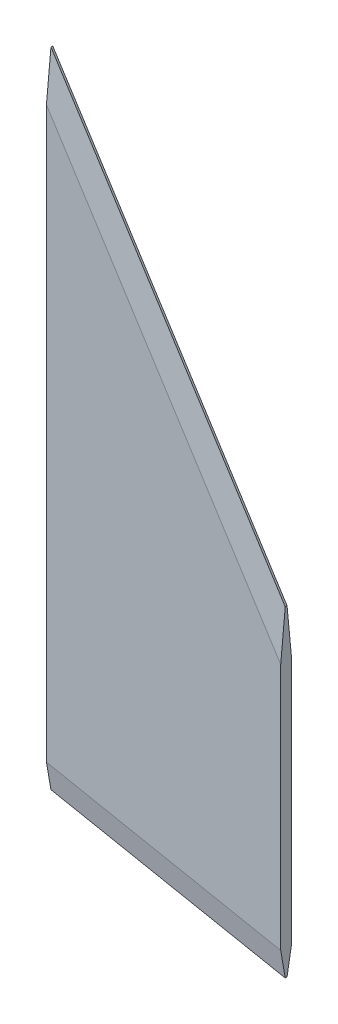
from build123d import *
from OCP.BRepFilletAPI import BRepFilletAPI_MakeChamfer

# Parameters (mm, degrees)
BOSS_EXTRUDE1_DEPTH = 1.5
CHAMFER1_SIZE       = 1.25
CHAMFER1_SIZE2      = 7.089102275


with BuildPart() as part:
    # Sketch1 → Boss-Extrude1 (new, symmetric)
    with BuildSketch(Plane.XY):
        Polygon((-60.98159975, 86.631512683), (-60.98159975, -91.168487317), (3.78840025, -103.868487317), (3.78840025, -14.968487317), align=None)
    extrude(amount=BOSS_EXTRUDE1_DEPTH, both=True)

    # Chamfer1: one chamfer whose edges measure the first distance from different faces: ONE call of the kernel's chamfer builder (chamfer() names one face for all edges)
    chamfer1_edges_1 = [part.edges().sort_by_distance(p)[0] for p in [
        (-28.59659975, -97.518487317, -1.5),
        (-28.59659975, -97.518487317, 1.5),
    ]]
    chamfer1_side_1 = [part.faces().sort_by_distance(p)[0] for p in [
        (-28.59659975, -97.518487317, 0),
    ]]
    chamfer1_edges_2 = [part.edges().sort_by_distance(p)[0] for p in [
        (-28.59659975, 35.831512683, -1.5),
        (-28.59659975, 35.831512683, 1.5),
    ]]
    chamfer1_side_2 = [part.faces().sort_by_distance(p)[0] for p in [
        (-28.59659975, 35.831512683, 0),
    ]]
    chamfer1 = BRepFilletAPI_MakeChamfer(part.part.solid().wrapped)
    for e in chamfer1_edges_1:
        chamfer1.Add(CHAMFER1_SIZE, CHAMFER1_SIZE2, e.wrapped, chamfer1_side_1[0].wrapped)  # the first distance lies on this face
    for e in chamfer1_edges_2:
        chamfer1.Add(CHAMFER1_SIZE, CHAMFER1_SIZE2, e.wrapped, chamfer1_side_2[0].wrapped)  # the first distance lies on this face
    add(Compound.cast(chamfer1.Shape()), mode=Mode.REPLACE)


solid = part.part
